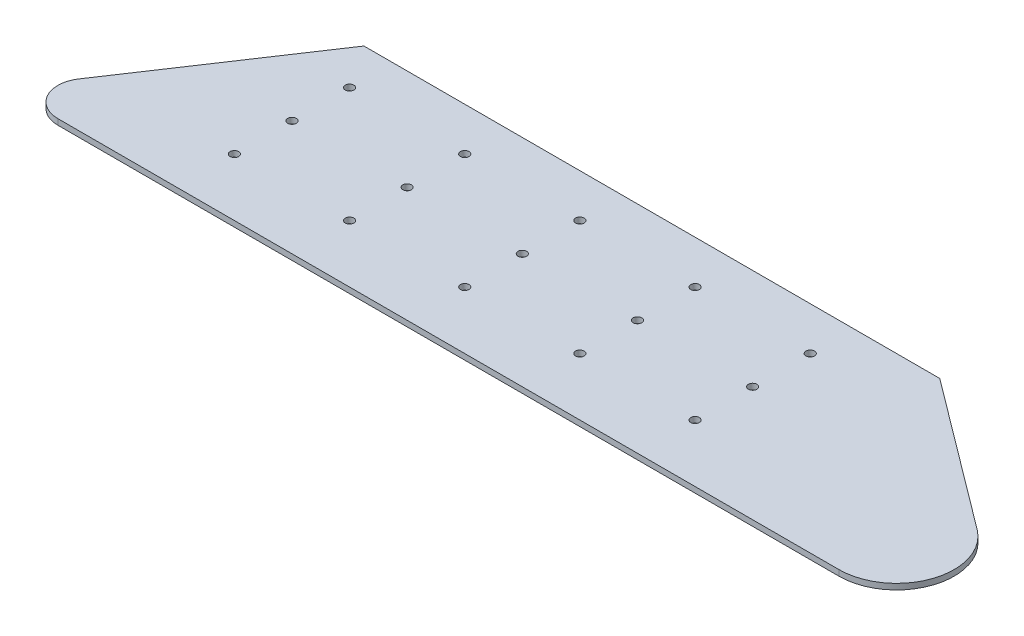
from build123d import *

# Parameters (mm, degrees)
SKETCH1_R           = 1.5
BOSS_EXTRUDE1_DEPTH = 2
FILLET4_R           = 20
FILLET5_R           = 10


with BuildPart() as part:
    # Sketch1 → Boss-Extrude1 (new body)
    with BuildSketch(Plane(origin=(0, 0, 0), x_dir=(1, 0, 0), z_dir=(0, 1, 0))):
        Polygon((-17.984046201, 0), (332.015953799, 0), (232.015953799, 75), (32.015953799, 75), align=None)
        with Locations((42.015953799, 20)):
            Circle(SKETCH1_R, mode=Mode.SUBTRACT)
        with Locations((82.015953799, 20)):
            Circle(SKETCH1_R, mode=Mode.SUBTRACT)
        with Locations((122.015953799, 20)):
            Circle(SKETCH1_R, mode=Mode.SUBTRACT)
        with Locations((162.015953799, 20)):
            Circle(SKETCH1_R, mode=Mode.SUBTRACT)
        with Locations((202.015953799, 20)):
            Circle(SKETCH1_R, mode=Mode.SUBTRACT)
        with Locations((42.015953799, 40)):
            Circle(SKETCH1_R, mode=Mode.SUBTRACT)
        with Locations((82.015953799, 40)):
            Circle(SKETCH1_R, mode=Mode.SUBTRACT)
        with Locations((122.015953799, 40)):
            Circle(SKETCH1_R, mode=Mode.SUBTRACT)
        with Locations((162.015953799, 40)):
            Circle(SKETCH1_R, mode=Mode.SUBTRACT)
        with Locations((202.015953799, 40)):
            Circle(SKETCH1_R, mode=Mode.SUBTRACT)
        with Locations((202.015953799, 60)):
            Circle(SKETCH1_R, mode=Mode.SUBTRACT)
        with Locations((162.015953799, 60)):
            Circle(SKETCH1_R, mode=Mode.SUBTRACT)
        with Locations((122.015953799, 60)):
            Circle(SKETCH1_R, mode=Mode.SUBTRACT)
        with Locations((82.015953799, 60)):
            Circle(SKETCH1_R, mode=Mode.SUBTRACT)
        with Locations((42.015953799, 60)):
            Circle(SKETCH1_R, mode=Mode.SUBTRACT)
    extrude(amount=BOSS_EXTRUDE1_DEPTH)

    # Fillet4
    fillet4_edges = [part.edges().sort_by_distance(p)[0] for p in [
        (332.015953799, 1, 0),
    ]]
    fillet(fillet4_edges, radius=FILLET4_R)

    # Fillet5
    fillet5_edges = [part.edges().sort_by_distance(p)[0] for p in [
        (-17.984046201, 1, 0),
    ]]
    fillet(fillet5_edges, radius=FILLET5_R)


solid = part.part
